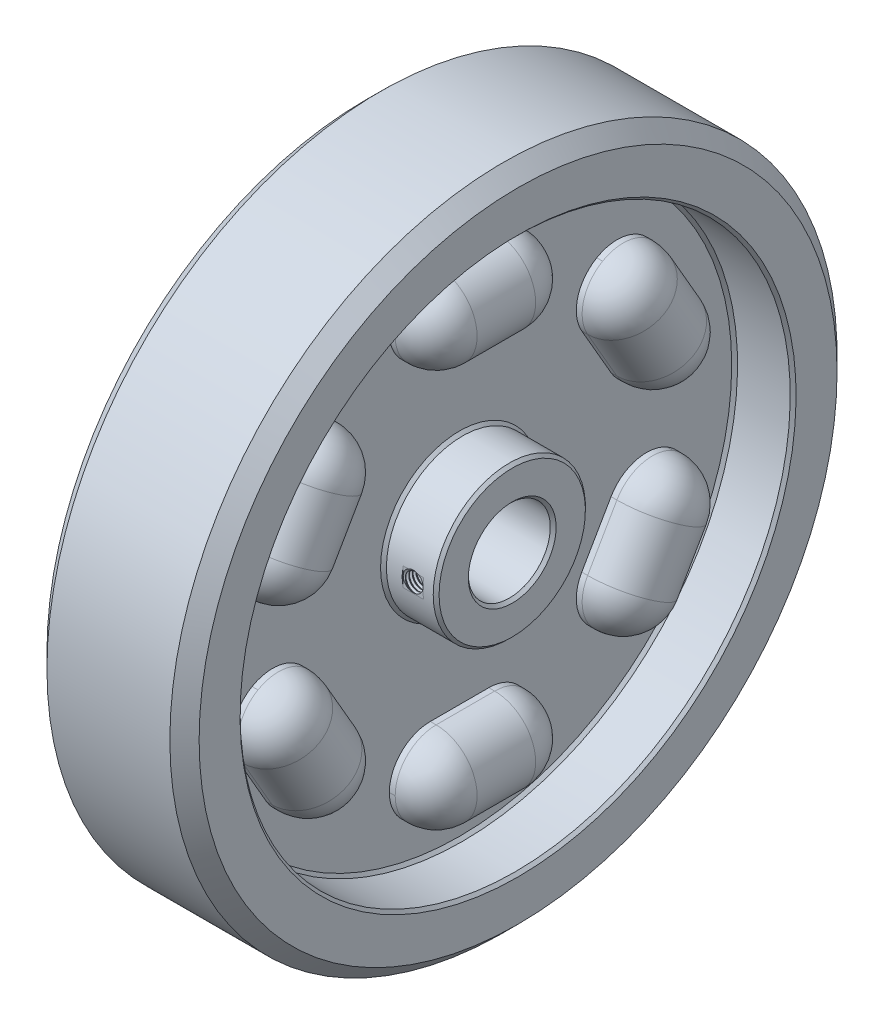
from build123d import *

# Parameters (mm, degrees)
CHAMFER1_SIZE                   = 2.5
CHAMFER2_SIZE                   = 0.5
CUT_EXTRUDE2_REACH              = 88.683
CUT_EXTRUDE2_END_RADIUS         = 13
SKETCH5_R                       = 1.5
CUT_EXTRUDE6_START              = 12.9
CUT_EXTRUDE6_DEPTH              = 10
THREAD1_PITCH                   = 0.6
WRAP2_DEPTH                     = 0.5
SKETCH14_W                      = 24
SKETCH14_H                      = 14
BOSS_EXTRUDE2_DEPTH             = 8
FILLET1_RADIUS                  = 7
FILLET1_LENGTH                  = 24
FILLET2_R                       = 7
CIRPATTERN4_COUNT               = 6
FILLET1_OF_CIRPATTERN4_2_RADIUS = 7
FILLET1_OF_CIRPATTERN4_2_LENGTH = 24
FILLET1_OF_CIRPATTERN4_3_RADIUS = 7
FILLET1_OF_CIRPATTERN4_3_LENGTH = 24
FILLET1_OF_CIRPATTERN4_4_RADIUS = 7
FILLET1_OF_CIRPATTERN4_4_LENGTH = 24
FILLET1_OF_CIRPATTERN4_5_RADIUS = 7
FILLET1_OF_CIRPATTERN4_5_LENGTH = 24
FILLET1_OF_CIRPATTERN4_6_RADIUS = 7
FILLET1_OF_CIRPATTERN4_6_LENGTH = 24
FILLET2_OF_CIRPATTERN4_R        = 7


# Read off the part's stored shape, not the designer's step: Wrap2
with BuildPart() as part:
    # Sketch1 → Revolve1 (revolve)
    with BuildSketch(Plane.XY, mode=Mode.PRIVATE) as revolve1_sk:
        Polygon((-12, 0), (12, 0), (12, 6), (3, 6), (3, 40), (13, 40), (13, 50), (-13, 50), (-13, 40), (-3, 40), (-3, 6), (-12, 6), align=None)
    revolve(revolve1_sk.sketch.rotate(Axis((-24.560426167, -7, 0), (1, 0, 0)), 180), axis=Axis((-24.560426167, -7, 0), (1, 0, 0)))

    # Chamfer1
    chamfer1_edges = [part.edges().sort_by_distance(p)[0] for p in [
        (-13, 50, 0),
        (13, 50, 0),
    ]]
    chamfer(chamfer1_edges, length=CHAMFER1_SIZE)

    # Chamfer2
    chamfer2_edges = [part.edges().sort_by_distance(p)[0] for p in [
        (-3, 40, 0),
        (-13, 40, 0),
        (13, 40, 0),
        (3, 40, 0),
        (3, 6, 0),
        (12, 6, 0),
        (12, 0, 0),
        (-12, 0, 0),
        (-12, 6, 0),
        (-3, 6, 0),
    ]]
    chamfer(chamfer2_edges, length=CHAMFER2_SIZE)

    # Cut-Extrude2: up to this cylinder (the profile starts inside it)
    cut_extrude2_end = Plane(origin=(8, -7, 0), z_dir=(-1, 0, 0)) * Cylinder(CUT_EXTRUDE2_END_RADIUS, 204.366, mode=Mode.PRIVATE)
    # Sketch5 → Cut-Extrude2 (cut, up to the surface)
    with BuildSketch(Plane.XY, mode=Mode.PRIVATE) as cut_extrude2_sk1:
        with Locations(Location((8, -7, 0), (0, 0, 180))):
            Circle(SKETCH5_R)
    cut_extrude2_tool1 = extrude(cut_extrude2_sk1.sketch, amount=CUT_EXTRUDE2_REACH, mode=Mode.PRIVATE) & cut_extrude2_end
    add(cut_extrude2_tool1.solids().sort_by_distance((8, -7, 0))[0], mode=Mode.SUBTRACT)

    # Sketch9 → Cut-Extrude6 (cut)
    with BuildSketch(Plane.XY.offset(CUT_EXTRUDE6_START)):
        with BuildLine():
            Line((9.5, -5.25), (6.5, -5.25))
            ThreePointArc((6.5, -5.25), (6.323223305, -5.323223305), (6.25, -5.5))
            Line((6.25, -5.5), (6.25, -8.5))
            ThreePointArc((6.25, -8.5), (6.323223305, -8.676776695), (6.5, -8.75))
            Line((6.5, -8.75), (9.5, -8.75))
            ThreePointArc((9.5, -8.75), (9.676776695, -8.676776695), (9.75, -8.5))
            Line((9.75, -8.5), (9.75, -5.5))
            ThreePointArc((9.75, -5.5), (9.676776695, -5.323223305), (9.5, -5.25))
        make_face()
    extrude(amount=CUT_EXTRUDE6_DEPTH, mode=Mode.SUBTRACT)

    # Thread1: the profile of Thread Profile1 profile screwed along a right-hand helix of 16.666667 turns, 6 arcs to a turn; built about Z, then put on its axis
    thread1_z = Axis((0, 0, 0), (0, 0, 1))
    thread1_corners = [(1.4997, 0, -0.000173205), (1.4997, 0, 0.525173203), (1.824759525, 0, 0.337499999), (1.824759525, 0, 0.187499999)]
    with BuildLine(mode=Mode.PRIVATE) as thread1_profile:
        Line(thread1_corners[0], thread1_corners[1])
        Line(thread1_corners[1], thread1_corners[2])
        Line(thread1_corners[2], thread1_corners[3])
        Line(thread1_corners[3], thread1_corners[0])
    thread1_cap = Face(thread1_profile.wire())
    thread1_turn_angles = [0, 30, 60, 90, 120, 150, 180, 210, 240, 270, 300, 330, 360]
    thread1_turn_weights = [1, 0.8660254037844387, 1, 0.8660254037844387, 1, 0.8660254037844387, 1, 0.8660254037844387, 1, 0.8660254037844387, 1, 0.8660254037844387, 1]
    thread1_turn_rails = [Edge.make_bspline([Vector(p[0], p[1], 0).rotate(thread1_z, thread1_turn_angles[k]) / thread1_turn_weights[k] + Vector(0, 0, p[2] + THREAD1_PITCH * thread1_turn_angles[k] / 360) for k in range(13)], [0, 0, 0, 1, 1, 2, 2, 3, 3, 4, 4, 5, 5, 6, 6, 6], 2, thread1_turn_weights) for p in thread1_corners]
    thread1_turn_sides = [Face.make_surface_from_curves(thread1_turn_rails[p[0]], thread1_turn_rails[p[1]]) for p in [(0, 1), (1, 2), (2, 3), (3, 0)]]
    thread1_last_angles = [5760, 5790, 5820, 5850, 5880, 5910, 5940, 5970, 6000]
    thread1_last_weights = [1, 0.8660254037844387, 1, 0.8660254037844387, 1, 0.8660254037844387, 1, 0.8660254037844387, 1]
    thread1_last_rails = [Edge.make_bspline([Vector(p[0], p[1], 0).rotate(thread1_z, thread1_last_angles[k]) / thread1_last_weights[k] + Vector(0, 0, p[2] + THREAD1_PITCH * thread1_last_angles[k] / 360) for k in range(9)], [0, 0, 0, 1, 1, 2, 2, 3, 3, 4, 4, 4], 2, thread1_last_weights) for p in thread1_corners]
    thread1_last_sides = [Face.make_surface_from_curves(thread1_last_rails[p[0]], thread1_last_rails[p[1]]) for p in [(0, 1), (1, 2), (2, 3), (3, 0)]]
    thread1 = Plane(origin=(8, -7, 13.9), x_dir=(-1, 0, 0), z_dir=(0, 0, -1)) * Solid(Shell([*[p.moved(Location((0, 0, THREAD1_PITCH * i))) for i in range(16) for p in thread1_turn_sides], *thread1_last_sides, thread1_cap, thread1_cap.rotate(thread1_z, 6000).moved(Location((0, 0, THREAD1_PITCH * 6000 / 360)))]))
    add(thread1, mode=Mode.SUBTRACT)

    # Wrap2 outline → Wrap2 (add)
    with BuildSketch(Plane.ZY.offset(3)):
        Polygon((18.263194329, -6.567149663), (17.686962358, -2.960929711), (26.166349377, -1.60430411), (26.015613199, -0.661725985), (16.62990106, -2.163363606), (17.356869209, -6.712161683), align=None)
        Polygon((21.075597524, 7.729198789), (23.453031418, 3.95316213), (24.239149206, 4.44925588), (21.357989351, 9.022858645), (13.376604134, 3.997047347), (16.236775408, -0.544118519), (17.022893197, -0.049932822), (14.666447884, 3.693666938), (17.797562668, 5.666593621), (20.15400798, 1.922993861), (20.936309663, 2.415271505), (18.579864351, 6.158871265), align=None)
        Polygon((13.640363549, 14.781159119), (17.29237677, 12.203379672), (17.828539631, 12.96278472), (13.405673044, 16.084359239), (7.960090112, 8.366285321), (12.352427852, 5.265699383), (12.890498766, 6.027012484), (9.269014391, 8.583803349), (11.404125569, 11.611883277), (15.025609944, 9.055092412), (15.559864751, 9.810681354), (11.938380376, 12.36747222), align=None)
        Polygon((5.87311572, 14.794006932), (1.101075455, 15.534331451), (1.711652378, 19.470644552), (0.7671662, 19.615656571), (-0.686770098, 10.229944432), (0.25771608, 10.084932413), (0.959879542, 14.614649961), (5.731919806, 13.874325441), (5.029756345, 9.344607893), (5.974242522, 9.199595874), (7.42817882, 18.585308013), (6.483692643, 18.730320033), align=None)
        Polygon((-11.603803471, 16.019577229), (-10.968421861, 8.736539369), (-15.730921861, 13.945523744), (-16.595269817, 13.510487686), (-9.985774625, 6.284691412), (-9.825498183, 6.364829633), (-10.481868375, 14.0161217), (-4.782514409, 8.900631917), (-4.622237966, 8.980770138), (-6.440612366, 18.614529152), (-7.299236164, 18.1833092), (-5.994127991, 11.2379967), (-11.432078712, 16.105439609), align=None)
        Polygon((-24.553566931, 3.382539265), (-21.556015849, -0.076760615), (-26.015135441, -1.198695711), (-26.347136643, -2.242400639), (-20.701208157, -0.828533452), (-16.383284479, -2.206147634), (-16.098984599, -1.31699499), (-20.416908277, 0.060619192), (-24.221565729, 4.426244192), align=None)
        Polygon((-18.32272481, -5.896727699), (-17.996447767, -9.53538455), (-26.555973008, -10.298605704), (-26.472018681, -11.252632147), (-16.998536109, -10.407364719), (-17.408767479, -5.814681425), align=None)
        Polygon((-22.741806008, -19.038677734), (-24.373191224, -15.619446965), (-25.212734493, -16.020138071), (-23.178750118, -20.282728215), (-14.670742306, -16.224299729), (-15.073341464, -15.380940354), (-19.24434507, -17.371039513), (-20.875730287, -13.951808744), (-21.713365503, -14.350591796), (-20.081980287, -17.769822566), align=None)
    extrude(amount=WRAP2_DEPTH)

    # Sketch14 → Boss-Extrude2 (add)
    with BuildSketch(Plane(origin=(3, 0, 0), x_dir=(0, 0, -1), z_dir=(1, 0, 0))):
        with Locations((0, 27)):
            Rectangle(SKETCH14_W, SKETCH14_H)
    boss_extrude2 = extrude(amount=BOSS_EXTRUDE2_DEPTH)

    # Fillet1: full round fillet: the end face becomes a half cylinder, R = half its width
    fillet1_face = Plane((11, 27, 0), x_dir=(0, 0, 1), z_dir=(1, 0, 0))  # on the end face: x along it, z out of the body
    fillet1_slab = fillet1_face.offset(-FILLET1_RADIUS / 2) * Box(FILLET1_LENGTH, 2 * FILLET1_RADIUS, FILLET1_RADIUS, mode=Mode.PRIVATE)  # the body's end, R deep
    fillet1_round = Plane((4, 27, 0), x_dir=(1, 0, 0), z_dir=(0, 0, 1)) * Cylinder(FILLET1_RADIUS, FILLET1_LENGTH, mode=Mode.PRIVATE)  # its axis R under the face
    add(fillet1_slab - fillet1_round, mode=Mode.SUBTRACT)

    # Fillet2
    fillet2_edges = [part.edges().sort_by_distance(p)[0] for p in [
        (3.5, 34, -12),
        (3.5, 20, -12),
        (3.5, 20, 12),
        (3.5, 34, 12),
        (11, 27, -12),
        (11, 27, 12),
    ]]
    fillet(fillet2_edges, radius=FILLET2_R - 0.0001)  # a hair under: the kernel refuses the full size

    # CirPattern4: Boss-Extrude2 ×6 about axis
    cirpattern4_axis = Axis((0, -7, 0), (1, 0, 0))
    for i in range(1, CIRPATTERN4_COUNT):
        add(boss_extrude2.rotate(cirpattern4_axis, i * 360 / CIRPATTERN4_COUNT))

    # Fillet1 of CirPattern4 2: full round fillet: the end face becomes a half cylinder, R = half its width
    fillet1_of_cirpattern4_2_face = Plane((11, 10, 29.444863729), x_dir=(0, -0.866025403784, 0.5), z_dir=(1, 0, 0))  # on the end face: x along it, z out of the body
    fillet1_of_cirpattern4_2_slab = fillet1_of_cirpattern4_2_face.offset(-FILLET1_OF_CIRPATTERN4_2_RADIUS / 2) * Box(FILLET1_OF_CIRPATTERN4_2_LENGTH, 2 * FILLET1_OF_CIRPATTERN4_2_RADIUS, FILLET1_OF_CIRPATTERN4_2_RADIUS, mode=Mode.PRIVATE)  # the body's end, R deep
    fillet1_of_cirpattern4_2_round = Plane((4, 10, 29.444863729), x_dir=(1, 0, 0), z_dir=(0, -0.866025403784, 0.5)) * Cylinder(FILLET1_OF_CIRPATTERN4_2_RADIUS, FILLET1_OF_CIRPATTERN4_2_LENGTH, mode=Mode.PRIVATE)  # its axis R under the face
    add(fillet1_of_cirpattern4_2_slab - fillet1_of_cirpattern4_2_round, mode=Mode.SUBTRACT)

    # Fillet1 of CirPattern4 3: full round fillet: the end face becomes a half cylinder, R = half its width
    fillet1_of_cirpattern4_3_face = Plane((11, -24, 29.444863729), x_dir=(0, -0.866025403784, -0.5), z_dir=(1, 0, 0))  # on the end face: x along it, z out of the body
    fillet1_of_cirpattern4_3_slab = fillet1_of_cirpattern4_3_face.offset(-FILLET1_OF_CIRPATTERN4_3_RADIUS / 2) * Box(FILLET1_OF_CIRPATTERN4_3_LENGTH, 2 * FILLET1_OF_CIRPATTERN4_3_RADIUS, FILLET1_OF_CIRPATTERN4_3_RADIUS, mode=Mode.PRIVATE)  # the body's end, R deep
    fillet1_of_cirpattern4_3_round = Plane((4, -24, 29.444863729), x_dir=(1, 0, 0), z_dir=(0, -0.866025403784, -0.5)) * Cylinder(FILLET1_OF_CIRPATTERN4_3_RADIUS, FILLET1_OF_CIRPATTERN4_3_LENGTH, mode=Mode.PRIVATE)  # its axis R under the face
    add(fillet1_of_cirpattern4_3_slab - fillet1_of_cirpattern4_3_round, mode=Mode.SUBTRACT)

    # Fillet1 of CirPattern4 4: full round fillet: the end face becomes a half cylinder, R = half its width
    fillet1_of_cirpattern4_4_face = Plane((11, -41, 0), x_dir=(0, 0, -1), z_dir=(1, 0, 0))  # on the end face: x along it, z out of the body
    fillet1_of_cirpattern4_4_slab = fillet1_of_cirpattern4_4_face.offset(-FILLET1_OF_CIRPATTERN4_4_RADIUS / 2) * Box(FILLET1_OF_CIRPATTERN4_4_LENGTH, 2 * FILLET1_OF_CIRPATTERN4_4_RADIUS, FILLET1_OF_CIRPATTERN4_4_RADIUS, mode=Mode.PRIVATE)  # the body's end, R deep
    fillet1_of_cirpattern4_4_round = Plane((4, -41, 0), x_dir=(1, 0, 0), z_dir=(0, 0, -1)) * Cylinder(FILLET1_OF_CIRPATTERN4_4_RADIUS, FILLET1_OF_CIRPATTERN4_4_LENGTH, mode=Mode.PRIVATE)  # its axis R under the face
    add(fillet1_of_cirpattern4_4_slab - fillet1_of_cirpattern4_4_round, mode=Mode.SUBTRACT)

    # Fillet1 of CirPattern4 5: full round fillet: the end face becomes a half cylinder, R = half its width
    fillet1_of_cirpattern4_5_face = Plane((11, -24, -29.444863729), x_dir=(0, 0.866025403784, -0.5), z_dir=(1, 0, 0))  # on the end face: x along it, z out of the body
    fillet1_of_cirpattern4_5_slab = fillet1_of_cirpattern4_5_face.offset(-FILLET1_OF_CIRPATTERN4_5_RADIUS / 2) * Box(FILLET1_OF_CIRPATTERN4_5_LENGTH, 2 * FILLET1_OF_CIRPATTERN4_5_RADIUS, FILLET1_OF_CIRPATTERN4_5_RADIUS, mode=Mode.PRIVATE)  # the body's end, R deep
    fillet1_of_cirpattern4_5_round = Plane((4, -24, -29.444863729), x_dir=(1, 0, 0), z_dir=(0, 0.866025403784, -0.5)) * Cylinder(FILLET1_OF_CIRPATTERN4_5_RADIUS, FILLET1_OF_CIRPATTERN4_5_LENGTH, mode=Mode.PRIVATE)  # its axis R under the face
    add(fillet1_of_cirpattern4_5_slab - fillet1_of_cirpattern4_5_round, mode=Mode.SUBTRACT)

    # Fillet1 of CirPattern4 6: full round fillet: the end face becomes a half cylinder, R = half its width
    fillet1_of_cirpattern4_6_face = Plane((11, 10, -29.444863729), x_dir=(0, 0.866025403784, 0.5), z_dir=(1, 0, 0))  # on the end face: x along it, z out of the body
    fillet1_of_cirpattern4_6_slab = fillet1_of_cirpattern4_6_face.offset(-FILLET1_OF_CIRPATTERN4_6_RADIUS / 2) * Box(FILLET1_OF_CIRPATTERN4_6_LENGTH, 2 * FILLET1_OF_CIRPATTERN4_6_RADIUS, FILLET1_OF_CIRPATTERN4_6_RADIUS, mode=Mode.PRIVATE)  # the body's end, R deep
    fillet1_of_cirpattern4_6_round = Plane((4, 10, -29.444863729), x_dir=(1, 0, 0), z_dir=(0, 0.866025403784, 0.5)) * Cylinder(FILLET1_OF_CIRPATTERN4_6_RADIUS, FILLET1_OF_CIRPATTERN4_6_LENGTH, mode=Mode.PRIVATE)  # its axis R under the face
    add(fillet1_of_cirpattern4_6_slab - fillet1_of_cirpattern4_6_round, mode=Mode.SUBTRACT)

    # Fillet2 of CirPattern4
    fillet2_of_cirpattern4_edges = [part.edges().sort_by_distance(p)[0] for p in [
        (3.5, 23.892304845, 29.507041555),
        (3.5, 16.892304845, 17.382685902),
        (3.5, -3.892304845, 29.382685902),
        (3.5, 3.107695155, 41.507041555),
        (11, 20.392304845, 23.444863729),
        (11, -0.392304845, 35.444863729),
        (3.5, -17.107695155, 41.507041555),
        (3.5, -10.107695155, 29.382685902),
        (3.5, -30.892304845, 17.382685902),
        (3.5, -37.892304845, 29.507041555),
        (11, -13.607695155, 35.444863729),
        (11, -34.392304845, 23.444863729),
        (3.5, -48, 12),
        (3.5, -34, 12),
        (3.5, -34, -12),
        (3.5, -48, -12),
        (11, -41, 12),
        (11, -41, -12),
        (3.5, -37.892304845, -29.507041555),
        (3.5, -30.892304845, -17.382685902),
        (3.5, -10.107695155, -29.382685902),
        (3.5, -17.107695155, -41.507041555),
        (11, -34.392304845, -23.444863729),
        (11, -13.607695155, -35.444863729),
        (3.5, 3.107695155, -41.507041555),
        (3.5, -3.892304845, -29.382685902),
        (3.5, 16.892304845, -17.382685902),
        (3.5, 23.892304845, -29.507041555),
        (11, -0.392304845, -35.444863729),
        (11, 20.392304845, -23.444863729),
    ]]
    fillet(fillet2_of_cirpattern4_edges, radius=FILLET2_OF_CIRPATTERN4_R - 0.0001)  # a hair under: the kernel refuses the full size


solid = part.part
